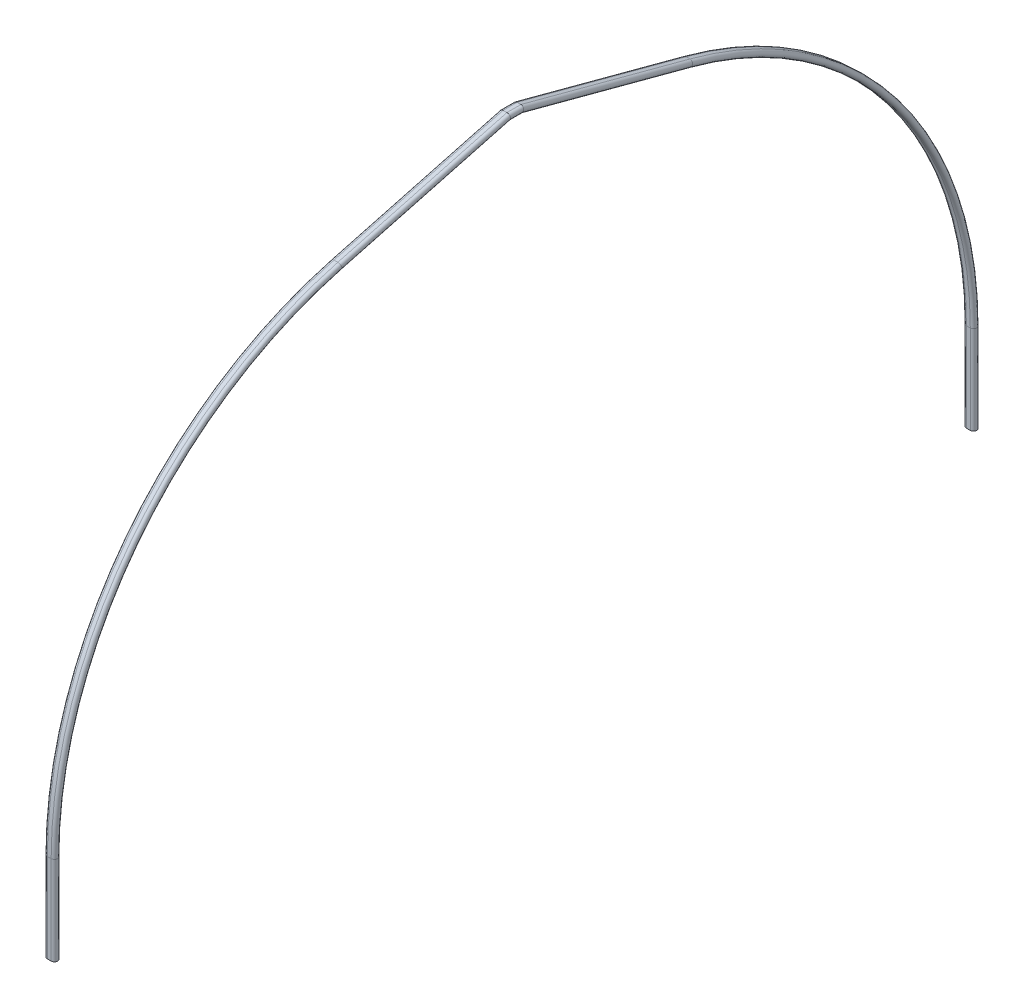
from build123d import *

# Parameters (mm, degrees)
F_3DSKETCH8_R      = 6.35
CUT_EXTRUDE1_DEPTH = 25.4
SKETCH5_R          = 6.35
CUT_EXTRUDE2_DEPTH = 12.7


with BuildPart() as part:
    # Sweep1: sweep along a path in Sketch4
    with BuildLine(Plane(origin=(0, 0, 0), x_dir=(0, 0, -1), z_dir=(1, 0, 0))) as sweep1_path:
        Line((0, 0), (0, 882.85962715))
        ThreePointArc((0, 882.85962715), (788.712459745, 3204.049321919), (2828.305301365, 4564.214747031))
        Line((2828.305301365, 4564.214747031), (4506.553686758, 5011.747649802))
        Line((4506.553686758, 5011.747649802), (4637.446313242, 5011.747649802))
        Line((4637.446313242, 5011.747649802), (6315.694698635, 4564.214747031))
        ThreePointArc((6315.694698635, 4564.214747031), (8355.287540255, 3204.049321919), (9144, 882.85962715))
        Line((9144, 882.85962715), (9144, 0))
    # Sketch1 → Sweep1 (sweep)
    with BuildSketch(Plane(origin=(0, 0, 0), x_dir=(1, 0, 0), z_dir=(0, 1, 0))):
        with BuildLine():
            Line((0, 31.75), (38.1, 31.75))
            ThreePointArc((38.1, 31.75), (69.85, 0), (38.1, -31.75))
            Line((38.1, -31.75), (0, -31.75))
            ThreePointArc((0, -31.75), (-31.75, 0), (0, 31.75))
        make_face()
        with BuildLine():
            Line((0, 20.304779167), (38.1, 20.304779167))
            ThreePointArc((38.1, 20.304779167), (58.404779167, 0), (38.1, -20.304779167))
            Line((38.1, -20.304779167), (0, -20.304779167))
            ThreePointArc((0, -20.304779167), (-20.304779167, 0), (0, 20.304779167))
        make_face(mode=Mode.SUBTRACT)
    sweep(path=sweep1_path.line, transition=Transition.RIGHT)

    # 3DSketch8 → Cut-Extrude1 (cut)
    with BuildSketch(Plane(origin=(0, 4979.997649802, -4552.95), x_dir=(0, 0, 1), z_dir=(0, 1, 0))):
        Circle(F_3DSKETCH8_R)
        with Locations((-38.1, 0)):
            Circle(F_3DSKETCH8_R)
        with Locations((-38.1, 38.1)):
            Circle(F_3DSKETCH8_R)
        with Locations((0, 38.1)):
            Circle(F_3DSKETCH8_R)
    extrude(amount=CUT_EXTRUDE1_DEPTH, mode=Mode.SUBTRACT)

    # Sketch5 → Cut-Extrude2 (cut)
    with BuildSketch(Plane(origin=(0, 3526.375982576, 940.366928687), x_dir=(1, 0, 0), z_dir=(0, -0.9662349396012464, -0.25766265056033216))):
        with Locations((0, -5080.158375128)):
            Circle(SKETCH5_R)
        with Locations((0, -5288.438375128)):
            Circle(SKETCH5_R)
        with Locations((38.1, -5288.438375128)):
            Circle(SKETCH5_R)
        with Locations((38.1, -5080.158375128)):
            Circle(SKETCH5_R)
    extrude(amount=-CUT_EXTRUDE2_DEPTH, mode=Mode.SUBTRACT)


solid = part.part
